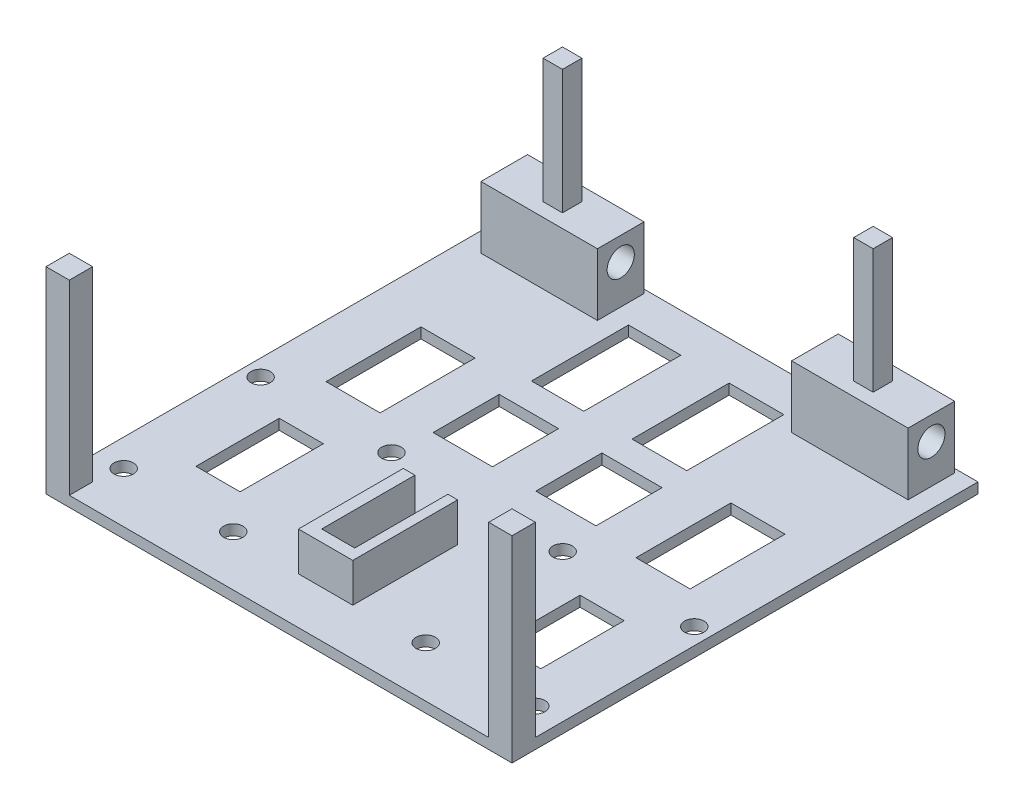
from build123d import *

# Parameters (mm, degrees)
SKETCH1_W                 = 120
SKETCH1_H                 = 120
BOSS_EXTRUDE1_DEPTH       = 2.7
CUT_EXTRUDE1_REACH        = 171.727
SKETCH2_W                 = 13.492346384
SKETCH2_H                 = 25
SKETCH2_W_2               = 14.089535058
SKETCH2_3_W               = 30
SKETCH2_3_H               = 12
BOSS_EXTRUDE2_DEPTH       = 16
CUT_EXTRUDE2_REACH        = 169.256
SKETCH4_R                 = 3.5
CUT_EXTRUDE3_REACH        = 169.256
SKETCH5_R                 = 3.5
CUT_EXTRUDE4_REACH        = 172.458
SKETCH6_R                 = 2.5
BOSS_EXTRUDE4_START       = 56
BOSS_EXTRUDE4_OUTLINE_W   = 1
BOSS_EXTRUDE4_OUTLINE_H   = 24
BOSS_EXTRUDE4_DEPTH       = 8.5
BOSS_EXTRUDE5_START       = -39
BOSS_EXTRUDE5_OUTLINE_W   = 2.5
BOSS_EXTRUDE5_OUTLINE_H   = 10
BOSS_EXTRUDE5_OUTLINE_W_2 = 3
BOSS_EXTRUDE5_DEPTH       = 27
BOSS_EXTRUDE5_START_2     = -15
BOSS_EXTRUDE5_2_OUTLINE_W = 8.5
BOSS_EXTRUDE5_2_OUTLINE_H = 10
BOSS_EXTRUDE5_2_DEPTH     = 3
CUT_EXTRUDE5_REACH        = 172.458
SKETCH8_W                 = 13.93792073
SKETCH8_H                 = 24.444968664
SKETCH8_W_2               = 11.364766133
SKETCH8_H_2               = 21.442954969
SKETCH8_W_3               = 15.276468839
SKETCH8_H_3               = 17.022275105
SKETCH8_H_4               = 21.442954968
SKETCH8_W_4               = 15.490753693
SKETCH9_W                 = 5
SKETCH9_H                 = 5
BOSS_EXTRUDE6_DEPTH       = 32
SKETCH10_W                = 6
SKETCH10_H                = 6
BOSS_EXTRUDE7_DEPTH       = 48


# Read off the part's stored shape, not the designer's step: Boss-Extrude4, Boss-Extrude5
with BuildPart() as part:
    # Sketch1 → Boss-Extrude1 (new body)
    with BuildSketch(Plane(origin=(0, 0, 0), x_dir=(1, 0, 0), z_dir=(0, 1, 0))):
        with Locations((60, 60)):
            Rectangle(SKETCH1_W, SKETCH1_H)
    extrude(amount=BOSS_EXTRUDE1_DEPTH)

    # Sketch2 → Cut-Extrude1 (cut, up to next)
    with BuildSketch(Plane(origin=(0, 2.7, 0), x_dir=(1, 0, 0), z_dir=(0, 1, 0)), mode=Mode.PRIVATE) as cut_extrude1_sk1:
        with Locations((46.746173192, 97.5)):
            Rectangle(SKETCH2_W, SKETCH2_H)
    cut_extrude1_tool1 = extrude(cut_extrude1_sk1.sketch, amount=-CUT_EXTRUDE1_REACH, mode=Mode.PRIVATE) & part.part
    # Sketch2 → Cut-Extrude1 (cut, up to next)
    with BuildSketch(Plane(origin=(0, 2.7, 0), x_dir=(1, 0, 0), z_dir=(0, 1, 0)), mode=Mode.PRIVATE) as cut_extrude1_sk2:
        with Locations((72.955232471, 97.5)):
            Rectangle(SKETCH2_W_2, SKETCH2_H)
    cut_extrude1_tool2 = extrude(cut_extrude1_sk2.sketch, amount=-CUT_EXTRUDE1_REACH, mode=Mode.PRIVATE) & part.part
    add(cut_extrude1_tool1.solids().sort_by_distance((46.746173, 2.7, -97.5))[0], mode=Mode.SUBTRACT)
    add(cut_extrude1_tool2.solids().sort_by_distance((72.955232, 2.7, -97.5))[0], mode=Mode.SUBTRACT)

    # Sketch2<3> → Boss-Extrude2 (add)
    with BuildSketch(Plane(origin=(0, 2.7, 0), x_dir=(1, 0, 0), z_dir=(0, 1, 0))):
        with Locations((20, 113)):
            Rectangle(SKETCH2_3_W, SKETCH2_3_H)
        with Locations((100, 113)):
            Rectangle(SKETCH2_3_W, SKETCH2_3_H)
    extrude(amount=BOSS_EXTRUDE2_DEPTH)

    # Sketch4 → Cut-Extrude2 (cut, up to next)
    with BuildSketch(Plane.ZY.offset(-5), mode=Mode.PRIVATE) as cut_extrude2_sk1:
        with Locations((-113, 12.7)):
            Circle(SKETCH4_R)
    cut_extrude2_tool1 = extrude(cut_extrude2_sk1.sketch, amount=-CUT_EXTRUDE2_REACH, mode=Mode.PRIVATE) & part.part
    add(cut_extrude2_tool1.solids().sort_by_distance((5, 12.7, -113))[0], mode=Mode.SUBTRACT)

    # Sketch5 → Cut-Extrude3 (cut, up to next)
    with BuildSketch(Plane(origin=(115, 0, 0), x_dir=(0, 0, -1), z_dir=(1, 0, 0)), mode=Mode.PRIVATE) as cut_extrude3_sk1:
        with Locations(Location((113, 12.7, 0), (0, 0, 180))):
            Circle(SKETCH5_R)
    cut_extrude3_tool1 = extrude(cut_extrude3_sk1.sketch, amount=-CUT_EXTRUDE3_REACH, mode=Mode.PRIVATE) & part.part
    add(cut_extrude3_tool1.solids().sort_by_distance((115, 12.7, -113))[0], mode=Mode.SUBTRACT)

    # Sketch6 → Cut-Extrude4 (cut, up to next)
    with BuildSketch(Plane(origin=(0, 2.7, 0), x_dir=(1, 0, 0), z_dir=(0, 1, 0)), mode=Mode.PRIVATE) as cut_extrude4_sk1:
        with Locations(Location((7, 13, 0), (0, 0, 270))):
            Circle(SKETCH6_R)
    cut_extrude4_tool1 = extrude(cut_extrude4_sk1.sketch, amount=-CUT_EXTRUDE4_REACH, mode=Mode.PRIVATE) & part.part
    # Sketch6 → Cut-Extrude4 (cut, up to next)
    with BuildSketch(Plane(origin=(0, 2.7, 0), x_dir=(1, 0, 0), z_dir=(0, 1, 0)), mode=Mode.PRIVATE) as cut_extrude4_sk2:
        with Locations(Location((4.26, 51, 0), (0, 0, 270))):
            Circle(SKETCH6_R)
    cut_extrude4_tool2 = extrude(cut_extrude4_sk2.sketch, amount=-CUT_EXTRUDE4_REACH, mode=Mode.PRIVATE) & part.part
    # Sketch6 → Cut-Extrude4 (cut, up to next)
    with BuildSketch(Plane(origin=(0, 2.7, 0), x_dir=(1, 0, 0), z_dir=(0, 1, 0)), mode=Mode.PRIVATE) as cut_extrude4_sk3:
        with Locations(Location((37.96, 51, 0), (0, 0, 270))):
            Circle(SKETCH6_R)
    cut_extrude4_tool3 = extrude(cut_extrude4_sk3.sketch, amount=-CUT_EXTRUDE4_REACH, mode=Mode.PRIVATE) & part.part
    # Sketch6 → Cut-Extrude4 (cut, up to next)
    with BuildSketch(Plane(origin=(0, 2.7, 0), x_dir=(1, 0, 0), z_dir=(0, 1, 0)), mode=Mode.PRIVATE) as cut_extrude4_sk4:
        with Locations(Location((84.78, 13, 0), (0, 0, 270))):
            Circle(SKETCH6_R)
    cut_extrude4_tool4 = extrude(cut_extrude4_sk4.sketch, amount=-CUT_EXTRUDE4_REACH, mode=Mode.PRIVATE) & part.part
    # Sketch6 → Cut-Extrude4 (cut, up to next)
    with BuildSketch(Plane(origin=(0, 2.7, 0), x_dir=(1, 0, 0), z_dir=(0, 1, 0)), mode=Mode.PRIVATE) as cut_extrude4_sk5:
        with Locations(Location((82.04, 51, 0), (0, 0, 270))):
            Circle(SKETCH6_R)
    cut_extrude4_tool5 = extrude(cut_extrude4_sk5.sketch, amount=-CUT_EXTRUDE4_REACH, mode=Mode.PRIVATE) & part.part
    # Sketch6 → Cut-Extrude4 (cut, up to next)
    with BuildSketch(Plane(origin=(0, 2.7, 0), x_dir=(1, 0, 0), z_dir=(0, 1, 0)), mode=Mode.PRIVATE) as cut_extrude4_sk6:
        with Locations(Location((115.74, 51.20220141, 0), (0, 0, 270))):
            Circle(SKETCH6_R)
    cut_extrude4_tool6 = extrude(cut_extrude4_sk6.sketch, amount=-CUT_EXTRUDE4_REACH, mode=Mode.PRIVATE) & part.part
    # Sketch6 → Cut-Extrude4 (cut, up to next)
    with BuildSketch(Plane(origin=(0, 2.7, 0), x_dir=(1, 0, 0), z_dir=(0, 1, 0)), mode=Mode.PRIVATE) as cut_extrude4_sk7:
        with Locations(Location((113, 13, 0), (0, 0, 270))):
            Circle(SKETCH6_R)
    cut_extrude4_tool7 = extrude(cut_extrude4_sk7.sketch, amount=-CUT_EXTRUDE4_REACH, mode=Mode.PRIVATE) & part.part
    # Sketch6 → Cut-Extrude4 (cut, up to next)
    with BuildSketch(Plane(origin=(0, 2.7, 0), x_dir=(1, 0, 0), z_dir=(0, 1, 0)), mode=Mode.PRIVATE) as cut_extrude4_sk8:
        with Locations(Location((35.22, 13, 0), (0, 0, 270))):
            Circle(SKETCH6_R)
    cut_extrude4_tool8 = extrude(cut_extrude4_sk8.sketch, amount=-CUT_EXTRUDE4_REACH, mode=Mode.PRIVATE) & part.part
    add(cut_extrude4_tool1.solids().sort_by_distance((7, 2.7, -13))[0], mode=Mode.SUBTRACT)
    add(cut_extrude4_tool2.solids().sort_by_distance((4.26, 2.7, -51))[0], mode=Mode.SUBTRACT)
    add(cut_extrude4_tool3.solids().sort_by_distance((37.96, 2.7, -51))[0], mode=Mode.SUBTRACT)
    add(cut_extrude4_tool4.solids().sort_by_distance((84.78, 2.7, -13))[0], mode=Mode.SUBTRACT)
    add(cut_extrude4_tool5.solids().sort_by_distance((82.04, 2.7, -51))[0], mode=Mode.SUBTRACT)
    add(cut_extrude4_tool6.solids().sort_by_distance((115.74, 2.7, -51.202201))[0], mode=Mode.SUBTRACT)
    add(cut_extrude4_tool7.solids().sort_by_distance((113, 2.7, -13))[0], mode=Mode.SUBTRACT)
    add(cut_extrude4_tool8.solids().sort_by_distance((35.22, 2.7, -13))[0], mode=Mode.SUBTRACT)

    # Boss-Extrude4 outline → Boss-Extrude4 (add)
    with BuildSketch(Plane.YZ.offset(BOSS_EXTRUDE4_START)):
        with Locations((3.2, -27)):
            Rectangle(BOSS_EXTRUDE4_OUTLINE_W, BOSS_EXTRUDE4_OUTLINE_H)
    extrude(amount=BOSS_EXTRUDE4_DEPTH)

    # Boss-Extrude5 outline → Boss-Extrude5 (add)
    with BuildSketch(Plane.XY.offset(BOSS_EXTRUDE5_START)):
        with Locations((65.75, 7.7)):
            Rectangle(BOSS_EXTRUDE5_OUTLINE_W, BOSS_EXTRUDE5_OUTLINE_H)
        with Locations((54.5, 7.7)):
            Rectangle(BOSS_EXTRUDE5_OUTLINE_W_2, BOSS_EXTRUDE5_OUTLINE_H)
    extrude(amount=BOSS_EXTRUDE5_DEPTH)

    # Boss-Extrude5 2 outline → Boss-Extrude5 2 (add)
    with BuildSketch(Plane.XY.offset(BOSS_EXTRUDE5_START_2)):
        with Locations((60.25, 7.7)):
            Rectangle(BOSS_EXTRUDE5_2_OUTLINE_W, BOSS_EXTRUDE5_2_OUTLINE_H)
    extrude(amount=BOSS_EXTRUDE5_2_DEPTH)

    # Sketch8 → Cut-Extrude5 (cut, up to next)
    with BuildSketch(Plane(origin=(0, 2.7, 0), x_dir=(1, 0, 0), z_dir=(0, 1, 0)), mode=Mode.PRIVATE) as cut_extrude5_sk1:
        with Locations((99.838592928, 71.277482239)):
            Rectangle(SKETCH8_W, SKETCH8_H)
    cut_extrude5_tool1 = extrude(cut_extrude5_sk1.sketch, amount=-CUT_EXTRUDE5_REACH, mode=Mode.PRIVATE) & part.part
    # Sketch8 → Cut-Extrude5 (cut, up to next)
    with BuildSketch(Plane(origin=(0, 2.7, 0), x_dir=(1, 0, 0), z_dir=(0, 1, 0)), mode=Mode.PRIVATE) as cut_extrude5_sk2:
        with Locations((21.518433658, 33.503955022)):
            Rectangle(SKETCH8_W_2, SKETCH8_H_2)
    cut_extrude5_tool2 = extrude(cut_extrude5_sk2.sketch, amount=-CUT_EXTRUDE5_REACH, mode=Mode.PRIVATE) & part.part
    # Sketch8 → Cut-Extrude5 (cut, up to next)
    with BuildSketch(Plane(origin=(0, 2.7, 0), x_dir=(1, 0, 0), z_dir=(0, 1, 0)), mode=Mode.PRIVATE) as cut_extrude5_sk3:
        with Locations((20.660272656, 70.634411505)):
            Rectangle(SKETCH8_W, SKETCH8_H)
    cut_extrude5_tool3 = extrude(cut_extrude5_sk3.sketch, amount=-CUT_EXTRUDE5_REACH, mode=Mode.PRIVATE) & part.part
    # Sketch8 → Cut-Extrude5 (cut, up to next)
    with BuildSketch(Plane(origin=(0, 2.7, 0), x_dir=(1, 0, 0), z_dir=(0, 1, 0)), mode=Mode.PRIVATE) as cut_extrude5_sk4:
        with Locations((46.474954565, 69.366478605)):
            Rectangle(SKETCH8_W_3, SKETCH8_H_3)
    cut_extrude5_tool4 = extrude(cut_extrude5_sk4.sketch, amount=-CUT_EXTRUDE5_REACH, mode=Mode.PRIVATE) & part.part
    # Sketch8 → Cut-Extrude5 (cut, up to next)
    with BuildSketch(Plane(origin=(0, 2.7, 0), x_dir=(1, 0, 0), z_dir=(0, 1, 0)), mode=Mode.PRIVATE) as cut_extrude5_sk5:
        with Locations((99.705334599, 32.777682609)):
            Rectangle(SKETCH8_W_2, SKETCH8_H_4)
    cut_extrude5_tool5 = extrude(cut_extrude5_sk5.sketch, amount=-CUT_EXTRUDE5_REACH, mode=Mode.PRIVATE) & part.part
    # Sketch8 → Cut-Extrude5 (cut, up to next)
    with BuildSketch(Plane(origin=(0, 2.7, 0), x_dir=(1, 0, 0), z_dir=(0, 1, 0)), mode=Mode.PRIVATE) as cut_extrude5_sk6:
        with Locations((72.867080872, 69.52199516)):
            Rectangle(SKETCH8_W_4, SKETCH8_H_3)
    cut_extrude5_tool6 = extrude(cut_extrude5_sk6.sketch, amount=-CUT_EXTRUDE5_REACH, mode=Mode.PRIVATE) & part.part
    add(cut_extrude5_tool1.solids().sort_by_distance((99.838593, 2.7, -71.277482))[0], mode=Mode.SUBTRACT)
    add(cut_extrude5_tool2.solids().sort_by_distance((21.518434, 2.7, -33.503955))[0], mode=Mode.SUBTRACT)
    add(cut_extrude5_tool3.solids().sort_by_distance((20.660273, 2.7, -70.634412))[0], mode=Mode.SUBTRACT)
    add(cut_extrude5_tool4.solids().sort_by_distance((46.474955, 2.7, -69.366479))[0], mode=Mode.SUBTRACT)
    add(cut_extrude5_tool5.solids().sort_by_distance((99.705335, 2.7, -32.777683))[0], mode=Mode.SUBTRACT)
    add(cut_extrude5_tool6.solids().sort_by_distance((72.867081, 2.7, -69.521995))[0], mode=Mode.SUBTRACT)

    # Sketch9 → Boss-Extrude6 (add)
    with BuildSketch(Plane(origin=(0, 18.7, 0), x_dir=(1, 0, 0), z_dir=(0, 1, 0))):
        with Locations((20, 113)):
            Rectangle(SKETCH9_W, SKETCH9_H)
        with Locations((100, 113)):
            Rectangle(SKETCH9_W, SKETCH9_H)
    extrude(amount=BOSS_EXTRUDE6_DEPTH)

    # Sketch10 → Boss-Extrude7 (add)
    with BuildSketch(Plane(origin=(0, 2.7, 0), x_dir=(1, 0, 0), z_dir=(0, 1, 0))):
        with Locations((117, 3)):
            Rectangle(SKETCH10_W, SKETCH10_H)
        with Locations((3, 3)):
            Rectangle(SKETCH10_W, SKETCH10_H)
    extrude(amount=BOSS_EXTRUDE7_DEPTH)


solid = part.part
